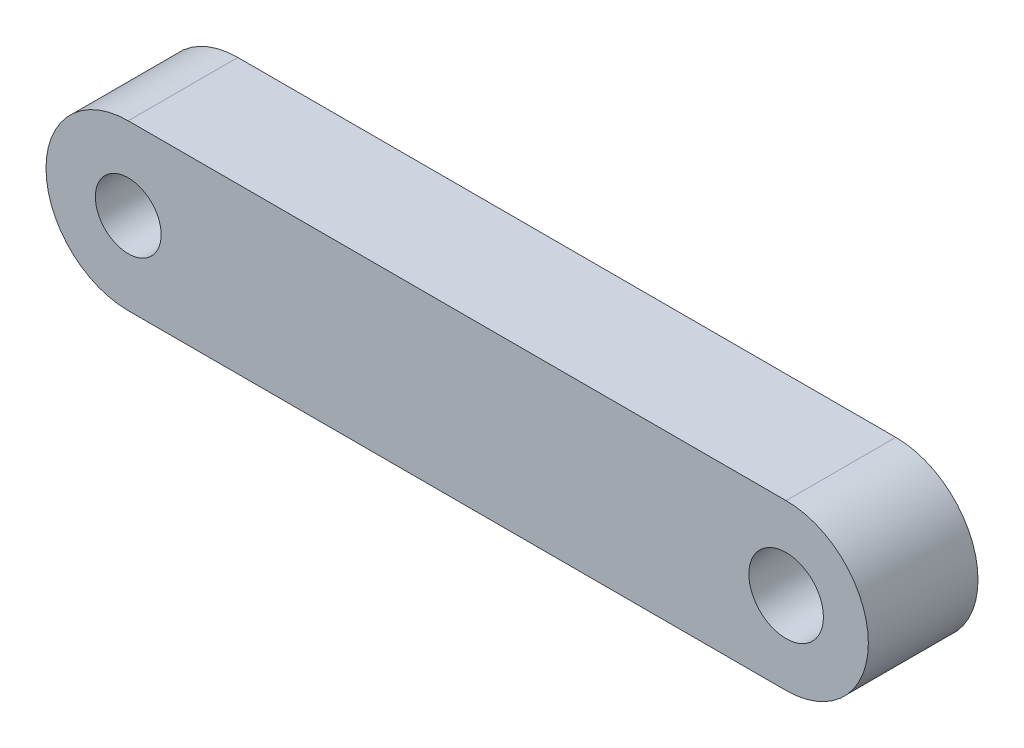
from build123d import *

# Parameters (mm, degrees)
SKETCH1_R           = 1.905
SKETCH1_R_2         = 2.159
BOSS_EXTRUDE1_DEPTH = 6.35


with BuildPart() as part:
    # Sketch1 → Boss-Extrude1 (new body)
    with BuildSketch(Plane.XY):
        with BuildLine():
            Line((0, 4.7625), (38.1, 4.7625))
            ThreePointArc((38.1, 4.7625), (42.8625, 0), (38.1, -4.7625))
            Line((38.1, -4.7625), (0, -4.7625))
            ThreePointArc((0, -4.7625), (-4.7625, 0), (0, 4.7625))
        make_face()
        Circle(SKETCH1_R, mode=Mode.SUBTRACT)
        with Locations((38.1, 0)):
            Circle(SKETCH1_R_2, mode=Mode.SUBTRACT)
    extrude(amount=BOSS_EXTRUDE1_DEPTH)


solid = part.part
